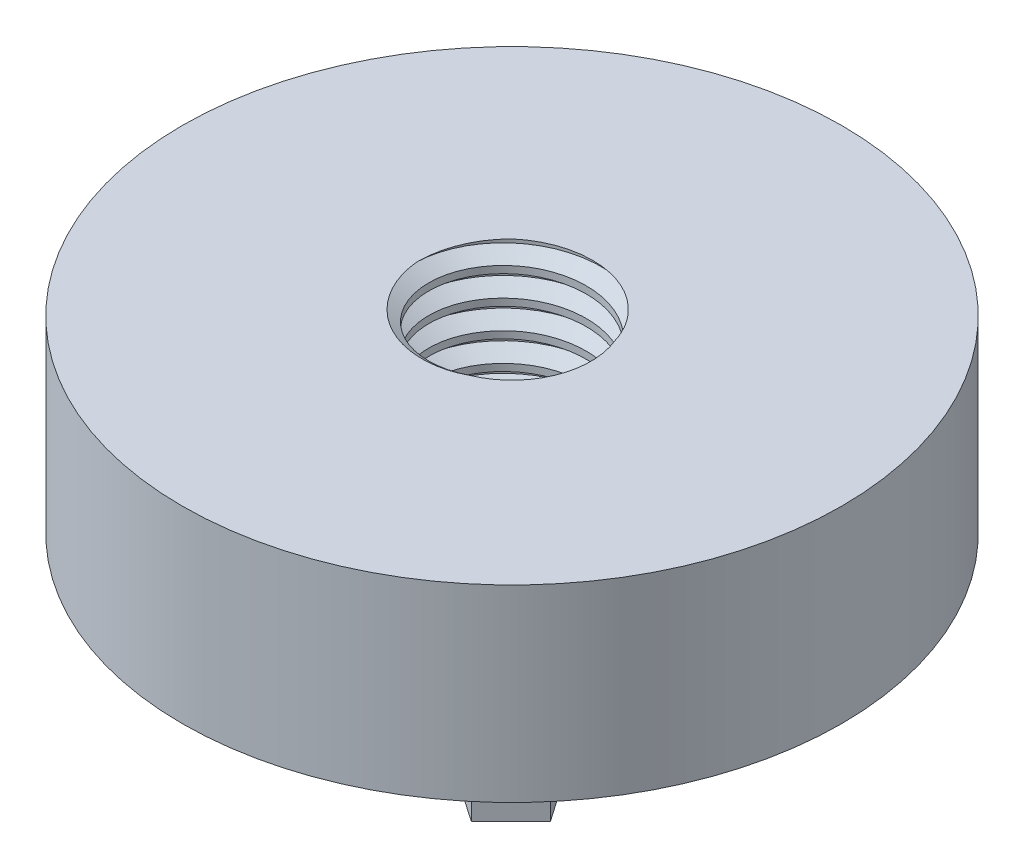
from build123d import *

# Parameters (mm, degrees)
ROSCA1_PITCH            = 1.5
CROQUIS5_R              = 17.5
CORTAR_EXTRUIR1_DEPTH   = 10
SALIENTE_EXTRUIR1_DEPTH = 2


with BuildPart() as part:
    # Croquis1 → Revolución1 (revolve)
    with BuildSketch(Plane.XY, mode=Mode.PRIVATE) as revoluci_n1_sk:
        Polygon((5, 0), (-7.5, 0), (-7.5, -5), (-7.5, -10), (10, -10), (10, -8), (5, -8), align=None)
    revolve(revoluci_n1_sk.sketch.rotate(Axis((10, -10, 0), (0, 1, 0)), 270), axis=Axis((10, -10, 0), (0, 1, 0)))

    # Rosca1: the profile of Perfil de rosca1 profile screwed along a right-hand helix of 6.333333 turns, 8 arcs to a turn; built about Z, then put on its axis
    rosca1_z = Axis((0, 0, 0), (0, 0, 1))
    rosca1_corners = [(5.0003, 0, -0.000173205), (5.0003, 0, 1.312673201), (4.188101187, 0, 0.843749998), (4.188101187, 0, 0.468749998)]
    with BuildLine(mode=Mode.PRIVATE) as rosca1_profile:
        Line(rosca1_corners[0], rosca1_corners[1])
        Line(rosca1_corners[1], rosca1_corners[2])
        Line(rosca1_corners[2], rosca1_corners[3])
        Line(rosca1_corners[3], rosca1_corners[0])
    rosca1_cap = Face(rosca1_profile.wire())
    rosca1_turn_angles = [0, 22.5, 45, 67.5, 90, 112.5, 135, 157.5, 180, 202.5, 225, 247.5, 270, 292.5, 315, 337.5, 360]
    rosca1_turn_weights = [1, 0.9238795325112867, 1, 0.9238795325112867, 1, 0.9238795325112867, 1, 0.9238795325112867, 1, 0.9238795325112867, 1, 0.9238795325112867, 1, 0.9238795325112867, 1, 0.9238795325112867, 1]
    rosca1_turn_rails = [Edge.make_bspline([Vector(p[0], p[1], 0).rotate(rosca1_z, rosca1_turn_angles[k]) / rosca1_turn_weights[k] + Vector(0, 0, p[2] + ROSCA1_PITCH * rosca1_turn_angles[k] / 360) for k in range(17)], [0, 0, 0, 1, 1, 2, 2, 3, 3, 4, 4, 5, 5, 6, 6, 7, 7, 8, 8, 8], 2, rosca1_turn_weights) for p in rosca1_corners]
    rosca1_turn_sides = [Face.make_surface_from_curves(rosca1_turn_rails[p[0]], rosca1_turn_rails[p[1]]) for p in [(0, 1), (1, 2), (2, 3), (3, 0)]]
    rosca1_last_angles = [2160, 2182.5, 2205, 2227.5, 2250, 2265, 2280]
    rosca1_last_weights = [1, 0.9238795325112867, 1, 0.9238795325112867, 1, 0.9659258262890714, 1]
    rosca1_last_rails = [Edge.make_bspline([Vector(p[0], p[1], 0).rotate(rosca1_z, rosca1_last_angles[k]) / rosca1_last_weights[k] + Vector(0, 0, p[2] + ROSCA1_PITCH * rosca1_last_angles[k] / 360) for k in range(7)], [0, 0, 0, 1, 1, 2, 2, 3, 3, 3], 2, rosca1_last_weights) for p in rosca1_corners]
    rosca1_last_sides = [Face.make_surface_from_curves(rosca1_last_rails[p[0]], rosca1_last_rails[p[1]]) for p in [(0, 1), (1, 2), (2, 3), (3, 0)]]
    rosca1 = Plane(origin=(10, 1.5, 0), x_dir=(-1, 0, 0), z_dir=(0, -1, 0)) * Solid(Shell([*[p.moved(Location((0, 0, ROSCA1_PITCH * i))) for i in range(6) for p in rosca1_turn_sides], *rosca1_last_sides, rosca1_cap, rosca1_cap.rotate(rosca1_z, 2280).moved(Location((0, 0, ROSCA1_PITCH * 2280 / 360)))]))
    add(rosca1)

    # Croquis5 → Cortar-Extruir1 (cut)
    with BuildSketch(Plane(origin=(0, 0, 0), x_dir=(1, 0, 0), z_dir=(0, 1, 0))):
        with Locations(Location((10, 0, 0), (0, 0, 90))):
            Circle(CROQUIS5_R)
    extrude(amount=CORTAR_EXTRUIR1_DEPTH, mode=Mode.SUBTRACT)

    # Croquis4 → Saliente-Extruir1 (add)
    # profile 1 of 4: a face of its own
    with BuildSketch(Plane.XZ.offset(10)):
        with BuildLine():
            Line((10.071299898, 2.363231056), (16.432037592, 8.723968749))
            Line((16.432037592, 8.723968749), (16.931473292, 10.109196069))
            Line((16.931473292, 10.109196069), (20.154247057, 12.314251803))
            Line((20.154247057, 12.314251803), (22.255646325, 10.212852536))
            Line((22.255646325, 10.212852536), (20.041167276, 7.018348716))
            Line((20.041167276, 7.018348716), (18.599400065, 6.556606276))
            Line((18.599400065, 6.556606276), (12.238662371, 0.195868582))
            Line((12.238662371, 0.195868582), (13.774662733, -1.340131779))
            Line((13.774662733, -1.340131779), (12.10673596, -3.008058552))
            Line((12.10673596, -3.008058552), (10.432811271, -3.54415208))
            Line((10.432811271, -3.54415208), (9.844230287, -5.176631413))
            Line((9.844230287, -5.176631413), (3.296086509, -11.724775191))
            ThreePointArc((3.296086509, -11.724775191), (-1.539262366, -11.471383741), (-1.792653815, -6.636034866))
            Line((-1.792653815, -6.636034866), (4.81889137, -0.151292497))
            Line((4.81889137, -0.151292497), (6.420827725, 0.60161759))
            Line((6.420827725, 0.60161759), (6.97102923, 2.127648178))
            Line((6.97102923, 2.127648178), (8.638956003, 3.795574951))
            Line((8.638956003, 3.795574951), (10.071299898, 2.363231056))
        make_face()
        with BuildLine():
            Line((0.139125781, -7.945875665), (5.689458376, -2.395543071))
            ThreePointArc((5.689458376, -2.395543071), (7.415406244, -2.443404293), (7.621237972, -4.157702995))
            Line((7.621237972, -4.157702995), (1.835322499, -9.943618467))
            ThreePointArc((1.835322499, -9.943618467), (0.175207518, -9.634195141), (0.139125781, -7.945875665))
        make_face(mode=Mode.SUBTRACT)
    # profile 2 of 4: a face of its own
    with BuildSketch(Plane.XZ.offset(10)):
        with BuildLine():
            add(Edge.make_bspline(
                [(12.882044406, 8.874134948), (12.919860087, 8.912153002), (12.991475308, 8.984151476), (13.093123676, 9.087505085), (13.184040086, 9.180761529), (13.240972519, 9.240208208), (13.267877739, 9.268301615)],
                knots=[0, 0, 0, 0, 1.166586265, 2.209277478, 3.153737507, 4, 4, 4, 4], degree=3))
            add(Edge.make_bspline(
                [(13.267877739, 9.268301615), (13.275138075, 9.277298532), (13.289440012, 9.295021312), (13.295837101, 9.330309392), (13.288990885, 9.368144076), (13.276427894, 9.391933583), (13.269544406, 9.404968281)],
                knots=[0, 0, 0, 0, 0.926460074, 1.825008296, 2.808282984, 4, 4, 4, 4], degree=3))
            Line((13.269544406, 9.404968281), (13.095377739, 9.717468281))
            Line((13.095377739, 9.717468281), (13.188711073, 9.822468281))
            add(Edge.make_bspline(
                [(13.188711073, 9.822468281), (13.234746437, 9.774616935), (13.329536514, 9.676087622), (13.476602308, 9.526195739), (13.631253225, 9.368627), (13.737522972, 9.262114341), (13.792044406, 9.207468281)],
                knots=[0, 0, 0, 0, 0.924850036, 1.904331756, 2.924822523, 4, 4, 4, 4], degree=3))
            add(Edge.make_bspline(
                [(13.792044406, 9.207468281), (13.848356161, 9.151279215), (13.957644158, 9.042229327), (14.118260801, 8.884515017), (14.269261638, 8.736335627), (14.367803434, 8.641558433), (14.415377739, 8.595801615)],
                knots=[0, 0, 0, 0, 1.093055221, 2.121365541, 3.093027194, 4, 4, 4, 4], degree=3))
            Line((14.415377739, 8.595801615), (14.326211073, 8.486634948))
            Line((14.326211073, 8.486634948), (13.987877739, 8.678301615))
            add(Edge.make_bspline(
                [(13.987877739, 8.678301615), (13.977846363, 8.683523961), (13.959073378, 8.693297199), (13.928096408, 8.695617438), (13.89852647, 8.688868733), (13.882268613, 8.677032024), (13.873711073, 8.670801615)],
                knots=[0, 0, 0, 0, 1.095926169, 2.050945571, 2.974089182, 4, 4, 4, 4], degree=3))
            add(Edge.make_bspline(
                [(13.873711073, 8.670801615), (13.845413569, 8.643264673), (13.785579023, 8.585038323), (13.690071909, 8.493623329), (13.586015321, 8.390720543), (13.51341781, 8.318594594), (13.475377739, 8.280801615)],
                knots=[0, 0, 0, 0, 0.849927862, 1.797156656, 2.845741181, 4, 4, 4, 4], degree=3))
            Line((13.475377739, 8.280801615), (11.897877739, 6.703301615))
            add(Edge.make_bspline(
                [(11.897877739, 6.703301615), (11.86673108, 6.671947832), (11.807066862, 6.611886849), (11.722074368, 6.52521014), (11.645061451, 6.445827594), (11.596728533, 6.395004815), (11.573711073, 6.370801615)],
                knots=[0, 0, 0, 0, 1.142022905, 2.187647269, 3.136907953, 4, 4, 4, 4], degree=3))
            add(Edge.make_bspline(
                [(11.573711073, 6.370801615), (11.566351075, 6.362333894), (11.552415813, 6.346301296), (11.543027312, 6.316504172), (11.543601067, 6.286053029), (11.551879279, 6.267834791), (11.556211073, 6.258301615)],
                knots=[0, 0, 0, 0, 1.087797874, 2.059613019, 2.98464105, 4, 4, 4, 4], degree=3))
            Line((11.556211073, 6.258301615), (11.743711073, 5.915801615))
            Line((11.743711073, 5.915801615), (11.648711073, 5.809134948))
            add(Edge.make_bspline(
                [(11.648711073, 5.809134948), (11.60293998, 5.857249977), (11.508696215, 5.956319965), (11.36273845, 6.107312412), (11.207768554, 6.264577467), (11.10154311, 6.371133369), (11.047044406, 6.425801615)],
                knots=[0, 0, 0, 0, 0.924919463, 1.90443114, 2.924873512, 4, 4, 4, 4], degree=3))
            add(Edge.make_bspline(
                [(11.047044406, 6.425801615), (10.990986748, 6.481688657), (10.881930171, 6.590413312), (10.721904843, 6.748178777), (10.569516372, 6.895518502), (10.470160206, 6.990031327), (10.422044406, 7.035801615)],
                knots=[0, 0, 0, 0, 1.087606908, 2.115869442, 3.087560901, 4, 4, 4, 4], degree=3))
            Line((10.422044406, 7.035801615), (10.512877739, 7.146634948))
            Line((10.512877739, 7.146634948), (10.851211073, 6.954968281))
            add(Edge.make_bspline(
                [(10.851211073, 6.954968281), (10.860673255, 6.949747118), (10.878527656, 6.939895189), (10.908531474, 6.937633178), (10.937438668, 6.944607359), (10.953483198, 6.956253834), (10.962044406, 6.962468281)],
                knots=[0, 0, 0, 0, 1.073940783, 2.026442503, 2.946928643, 4, 4, 4, 4], degree=3))
            add(Edge.make_bspline(
                [(10.962044406, 6.962468281), (10.987368587, 6.986586863), (11.039862961, 7.036582156), (11.120588118, 7.115314604), (11.207823363, 7.199177673), (11.266613458, 7.25845289), (11.297044406, 7.289134948)],
                knots=[0, 0, 0, 0, 0.896849667, 1.859075365, 2.891813894, 4, 4, 4, 4], degree=3))
            Line((11.297044406, 7.289134948), (12.882044406, 8.874134948))
        make_face()
    # profile 3 of 4: a face of its own
    with BuildSketch(Plane.XZ.offset(10)):
        with BuildLine():
            add(Edge.make_bspline(
                [(11.437660954, 10.3185184), (11.475476636, 10.356536454), (11.547091857, 10.428534927), (11.648740224, 10.531888537), (11.739656635, 10.625144981), (11.796589068, 10.68459166), (11.823494287, 10.712685066)],
                knots=[0, 0, 0, 0, 1.166586265, 2.209277478, 3.153737507, 4, 4, 4, 4], degree=3))
            add(Edge.make_bspline(
                [(11.823494287, 10.712685066), (11.830754623, 10.721681984), (11.84505656, 10.739404764), (11.851453649, 10.774692844), (11.844607433, 10.812527527), (11.832044442, 10.836317035), (11.825160954, 10.849351733)],
                knots=[0, 0, 0, 0, 0.926460074, 1.825008296, 2.808282984, 4, 4, 4, 4], degree=3))
            Line((11.825160954, 10.849351733), (11.650994287, 11.161851733))
            Line((11.650994287, 11.161851733), (11.744327621, 11.266851733))
            add(Edge.make_bspline(
                [(11.744327621, 11.266851733), (11.790362985, 11.219000387), (11.885153063, 11.120471074), (12.032218856, 10.970579191), (12.186869773, 10.813010451), (12.29313952, 10.706497793), (12.347660954, 10.651851733)],
                knots=[0, 0, 0, 0, 0.924850036, 1.904331756, 2.924822523, 4, 4, 4, 4], degree=3))
            add(Edge.make_bspline(
                [(12.347660954, 10.651851733), (12.403972709, 10.595662667), (12.513260707, 10.486612779), (12.673877349, 10.328898469), (12.824878186, 10.180719078), (12.923419982, 10.085941885), (12.970994287, 10.040185066)],
                knots=[0, 0, 0, 0, 1.093055221, 2.121365541, 3.093027194, 4, 4, 4, 4], degree=3))
            Line((12.970994287, 10.040185066), (12.881827621, 9.9310184))
            Line((12.881827621, 9.9310184), (12.543494287, 10.122685066))
            add(Edge.make_bspline(
                [(12.543494287, 10.122685066), (12.533462912, 10.127907412), (12.514689927, 10.137680651), (12.483712956, 10.14000089), (12.454143019, 10.133252185), (12.437885161, 10.121415476), (12.429327621, 10.115185066)],
                knots=[0, 0, 0, 0, 1.095926169, 2.050945571, 2.974089182, 4, 4, 4, 4], degree=3))
            add(Edge.make_bspline(
                [(12.429327621, 10.115185066), (12.401030117, 10.087648125), (12.341195571, 10.029421775), (12.245688458, 9.938006781), (12.14163187, 9.835103995), (12.069034359, 9.762978046), (12.030994287, 9.725185066)],
                knots=[0, 0, 0, 0, 0.849927862, 1.797156656, 2.845741181, 4, 4, 4, 4], degree=3))
            Line((12.030994287, 9.725185066), (10.453494287, 8.147685066))
            add(Edge.make_bspline(
                [(10.453494287, 8.147685066), (10.422347628, 8.116331283), (10.36268341, 8.056270301), (10.277690916, 7.969593592), (10.200677999, 7.890211046), (10.152345081, 7.839388267), (10.129327621, 7.815185066)],
                knots=[0, 0, 0, 0, 1.142022905, 2.187647269, 3.136907953, 4, 4, 4, 4], degree=3))
            add(Edge.make_bspline(
                [(10.129327621, 7.815185066), (10.121967623, 7.806717346), (10.108032361, 7.790684747), (10.09864386, 7.760887624), (10.099217616, 7.730436481), (10.107495827, 7.712218243), (10.111827621, 7.702685066)],
                knots=[0, 0, 0, 0, 1.087797874, 2.059613019, 2.98464105, 4, 4, 4, 4], degree=3))
            Line((10.111827621, 7.702685066), (10.299327621, 7.360185066))
            Line((10.299327621, 7.360185066), (10.204327621, 7.2535184))
            add(Edge.make_bspline(
                [(10.204327621, 7.2535184), (10.158556529, 7.301633429), (10.064312763, 7.400703417), (9.918354999, 7.551695864), (9.763385102, 7.708960918), (9.657159659, 7.815516821), (9.602660954, 7.870185066)],
                knots=[0, 0, 0, 0, 0.924919463, 1.90443114, 2.924873512, 4, 4, 4, 4], degree=3))
            add(Edge.make_bspline(
                [(9.602660954, 7.870185066), (9.546603296, 7.926072109), (9.437546719, 8.034796764), (9.277521392, 8.192562228), (9.12513292, 8.339901953), (9.025776755, 8.434414779), (8.977660954, 8.480185066)],
                knots=[0, 0, 0, 0, 1.087606908, 2.115869442, 3.087560901, 4, 4, 4, 4], degree=3))
            Line((8.977660954, 8.480185066), (9.068494287, 8.5910184))
            Line((9.068494287, 8.5910184), (9.406827621, 8.399351733))
            add(Edge.make_bspline(
                [(9.406827621, 8.399351733), (9.416289803, 8.394130569), (9.434144204, 8.384278641), (9.464148023, 8.38201663), (9.493055217, 8.38899081), (9.509099747, 8.400637286), (9.517660954, 8.406851733)],
                knots=[0, 0, 0, 0, 1.073940783, 2.026442503, 2.946928643, 4, 4, 4, 4], degree=3))
            add(Edge.make_bspline(
                [(9.517660954, 8.406851733), (9.542985136, 8.430970315), (9.59547951, 8.480965608), (9.676204666, 8.559698055), (9.763439912, 8.643561124), (9.822230006, 8.702836342), (9.852660954, 8.7335184)],
                knots=[0, 0, 0, 0, 0.896849667, 1.859075365, 2.891813894, 4, 4, 4, 4], degree=3))
            Line((9.852660954, 8.7335184), (11.437660954, 10.3185184))
        make_face()
    # profile 4 of 4: a face of its own
    with BuildSketch(Plane.XZ.offset(10)):
        with BuildLine():
            add(Edge.make_bspline(
                [(9.993277502, 11.762901851), (10.031093184, 11.800919905), (10.102708405, 11.872918379), (10.204356773, 11.976271988), (10.295273183, 12.069528432), (10.352205616, 12.128975112), (10.379110836, 12.157068518)],
                knots=[0, 0, 0, 0, 1.166586265, 2.209277478, 3.153737507, 4, 4, 4, 4], degree=3))
            add(Edge.make_bspline(
                [(10.379110836, 12.157068518), (10.386371172, 12.166065435), (10.400673109, 12.183788216), (10.407070197, 12.219076296), (10.400223981, 12.256910979), (10.387660991, 12.280700486), (10.380777502, 12.293735185)],
                knots=[0, 0, 0, 0, 0.926460074, 1.825008296, 2.808282984, 4, 4, 4, 4], degree=3))
            Line((10.380777502, 12.293735185), (10.206610836, 12.606235185))
            Line((10.206610836, 12.606235185), (10.299944169, 12.711235185))
            add(Edge.make_bspline(
                [(10.299944169, 12.711235185), (10.345979534, 12.663383838), (10.440769611, 12.564854525), (10.587835405, 12.414962642), (10.742486321, 12.257393903), (10.848756068, 12.150881244), (10.903277502, 12.096235185)],
                knots=[0, 0, 0, 0, 0.924850036, 1.904331756, 2.924822523, 4, 4, 4, 4], degree=3))
            add(Edge.make_bspline(
                [(10.903277502, 12.096235185), (10.959589257, 12.040046118), (11.068877255, 11.930996231), (11.229493897, 11.77328192), (11.380494735, 11.62510253), (11.479036531, 11.530325337), (11.526610836, 11.484568518)],
                knots=[0, 0, 0, 0, 1.093055221, 2.121365541, 3.093027194, 4, 4, 4, 4], degree=3))
            Line((11.526610836, 11.484568518), (11.437444169, 11.375401851))
            Line((11.437444169, 11.375401851), (11.099110836, 11.567068518))
            add(Edge.make_bspline(
                [(11.099110836, 11.567068518), (11.08907946, 11.572290864), (11.070306475, 11.582064102), (11.039329505, 11.584384342), (11.009759567, 11.577635636), (10.993501709, 11.565798928), (10.984944169, 11.559568518)],
                knots=[0, 0, 0, 0, 1.095926169, 2.050945571, 2.974089182, 4, 4, 4, 4], degree=3))
            add(Edge.make_bspline(
                [(10.984944169, 11.559568518), (10.956646665, 11.532031577), (10.896812119, 11.473805226), (10.801305006, 11.382390233), (10.697248418, 11.279487446), (10.624650907, 11.207361497), (10.586610836, 11.169568518)],
                knots=[0, 0, 0, 0, 0.849927862, 1.797156656, 2.845741181, 4, 4, 4, 4], degree=3))
            Line((10.586610836, 11.169568518), (9.009110836, 9.592068518))
            add(Edge.make_bspline(
                [(9.009110836, 9.592068518), (8.977964177, 9.560714735), (8.918299958, 9.500653752), (8.833307464, 9.413977043), (8.756294547, 9.334594497), (8.707961629, 9.283771718), (8.684944169, 9.259568518)],
                knots=[0, 0, 0, 0, 1.142022905, 2.187647269, 3.136907953, 4, 4, 4, 4], degree=3))
            add(Edge.make_bspline(
                [(8.684944169, 9.259568518), (8.677584171, 9.251100798), (8.66364891, 9.235068199), (8.654260408, 9.205271076), (8.654834164, 9.174819932), (8.663112375, 9.156601694), (8.667444169, 9.147068518)],
                knots=[0, 0, 0, 0, 1.087797874, 2.059613019, 2.98464105, 4, 4, 4, 4], degree=3))
            Line((8.667444169, 9.147068518), (8.854944169, 8.804568518))
            Line((8.854944169, 8.804568518), (8.759944169, 8.697901851))
            add(Edge.make_bspline(
                [(8.759944169, 8.697901851), (8.714173077, 8.746016881), (8.619929311, 8.845086869), (8.473971547, 8.996079316), (8.319001651, 9.15334437), (8.212776207, 9.259900272), (8.158277502, 9.314568518)],
                knots=[0, 0, 0, 0, 0.924919463, 1.90443114, 2.924873512, 4, 4, 4, 4], degree=3))
            add(Edge.make_bspline(
                [(8.158277502, 9.314568518), (8.102219844, 9.370455561), (7.993163267, 9.479180215), (7.83313794, 9.63694568), (7.680749469, 9.784285405), (7.581393303, 9.878798231), (7.533277502, 9.924568518)],
                knots=[0, 0, 0, 0, 1.087606908, 2.115869442, 3.087560901, 4, 4, 4, 4], degree=3))
            Line((7.533277502, 9.924568518), (7.624110836, 10.035401851))
            Line((7.624110836, 10.035401851), (7.962444169, 9.843735185))
            add(Edge.make_bspline(
                [(7.962444169, 9.843735185), (7.971906352, 9.838514021), (7.989760752, 9.828662093), (8.019764571, 9.826400082), (8.048671765, 9.833374262), (8.064716295, 9.845020737), (8.073277502, 9.851235185)],
                knots=[0, 0, 0, 0, 1.073940783, 2.026442503, 2.946928643, 4, 4, 4, 4], degree=3))
            add(Edge.make_bspline(
                [(8.073277502, 9.851235185), (8.098601684, 9.875353767), (8.151096058, 9.92534906), (8.231821215, 10.004081507), (8.31905646, 10.087944576), (8.377846555, 10.147219794), (8.408277502, 10.177901851)],
                knots=[0, 0, 0, 0, 0.896849667, 1.859075365, 2.891813894, 4, 4, 4, 4], degree=3))
            Line((8.408277502, 10.177901851), (9.993277502, 11.762901851))
        make_face()
    extrude(amount=SALIENTE_EXTRUIR1_DEPTH)


solid = part.part
